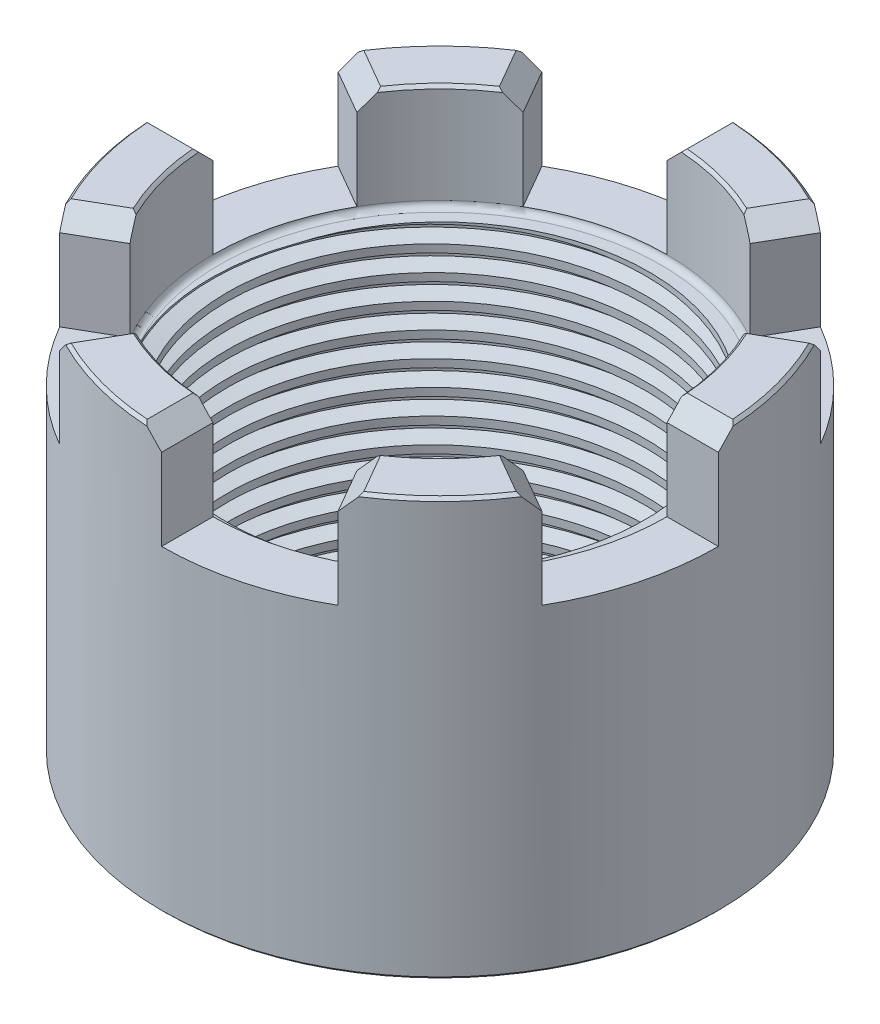
from build123d import *
from build123d.topology import SkipClean

# Parameters (mm, degrees)
SKETCH1_R           = 35.56
BOSS_EXTRUDE1_DEPTH = 40.64
SKETCH2_R           = 26.70175
CUT_EXTRUDE1_DEPTH  = 67.31
BOSS_EXTRUDE2_DEPTH = 12.7
CHAMFER1_SIZE       = 2.286
CHAMFER2_SIZE       = 2.286
CHAMFER3_SIZE       = 2.286
CHAMFER4_SIZE       = 2.286
CHAMFER5_SIZE       = 2.286
CHAMFER6_SIZE       = 2.286
CHAMFER7_SIZE       = 2.286
CHAMFER8_SIZE       = 2.286
CHAMFER9_SIZE       = 2.286
CHAMFER10_SIZE      = 2.286
CHAMFER11_SIZE      = 2.286
CHAMFER12_SIZE      = 2.286
CHAMFER13_SIZE      = 0.381
CHAMFER14_SIZE      = 0.381
CHAMFER15_SIZE      = 0.381
CHAMFER16_SIZE      = 0.381
CHAMFER17_SIZE      = 0.381
CHAMFER18_SIZE      = 0.381
CHAMFER20_SIZE      = 0.381
CHAMFER21_SIZE      = 0.381
CHAMFER22_SIZE      = 0.381
CHAMFER23_SIZE      = 0.381
CHAMFER24_SIZE      = 0.381
CHAMFER25_SIZE      = 0.381
CHAMFER26_SIZE      = 0.381
CUT_EXTRUDE2_START  = -0.762
SKETCH4_R           = 28.9941
CUT_EXTRUDE2_DEPTH  = 0.762
FILLET1_R           = 0.762
THREAD3_PITCH       = 3.175


with BuildPart() as part:
    # Sketch1 → Boss-Extrude1 (new body)
    with BuildSketch(Plane(origin=(0, 0, 0), x_dir=(1, 0, 0), z_dir=(0, 1, 0))):
        with Locations(Location((0, 0, 0), (0, 0, 270))):
            Circle(SKETCH1_R)
    extrude(amount=BOSS_EXTRUDE1_DEPTH)

    # Sketch2 → Cut-Extrude1 (cut)
    with BuildSketch(Plane(origin=(0, 40.64, 0), x_dir=(1, 0, 0), z_dir=(0, 1, 0))):
        with Locations(Location((0, 0, 0), (0, 0, 270))):
            Circle(SKETCH2_R)
    extrude(amount=-CUT_EXTRUDE1_DEPTH, mode=Mode.SUBTRACT)

    # Sketch3 → Boss-Extrude2 (add)
    with SkipClean():  # the faces are left unmerged after this step: merging them gives an invalid solid
        with BuildSketch(Plane(origin=(0, 40.64, 0), x_dir=(1, 0, 0), z_dir=(0, 1, 0))):
            with BuildLine():
                Line((-28.9941, 0), (-35.56, 0))
                ThreePointArc((-35.56, 0), (-34.348322383, -9.203605244), (-30.795863359, -17.78))
                Line((-30.795863359, -17.78), (-25.10962716, -14.49705))
                ThreePointArc((-25.10962716, -14.49705), (-28.00615, -7.504225276), (-28.9941, 0))
            make_face()
            with BuildLine():
                Line((-25.10962716, 14.49705), (-30.795863359, 17.78))
                ThreePointArc((-30.795863359, 17.78), (-25.144717139, 25.144717139), (-17.78, 30.795863359))
                Line((-17.78, 30.795863359), (-14.49705, 25.10962716))
                ThreePointArc((-14.49705, 25.10962716), (-20.501924724, 20.501924724), (-25.10962716, 14.49705))
            make_face()
            with BuildLine():
                Line((0, 28.9941), (0, 35.56))
                ThreePointArc((0, 35.56), (9.203605244, 34.348322383), (17.78, 30.795863359))
                Line((17.78, 30.795863359), (14.49705, 25.10962716))
                ThreePointArc((14.49705, 25.10962716), (7.504225276, 28.00615), (0, 28.9941))
            make_face()
            with BuildLine():
                Line((25.10962716, 14.49705), (30.795863359, 17.78))
                ThreePointArc((30.795863359, 17.78), (34.348322383, 9.203605244), (35.56, 0))
                Line((35.56, 0), (28.9941, 0))
                ThreePointArc((28.9941, 0), (28.00615, 7.504225276), (25.10962716, 14.49705))
            make_face()
            with BuildLine():
                Line((25.10962716, -14.49705), (30.795863359, -17.78))
                ThreePointArc((30.795863359, -17.78), (25.144717139, -25.144717139), (17.78, -30.795863359))
                Line((17.78, -30.795863359), (14.49705, -25.10962716))
                ThreePointArc((14.49705, -25.10962716), (20.501924724, -20.501924724), (25.10962716, -14.49705))
            make_face()
            with BuildLine():
                Line((0, -28.9941), (0, -35.56))
                ThreePointArc((0, -35.56), (-9.203605244, -34.348322383), (-17.78, -30.795863359))
                Line((-17.78, -30.795863359), (-14.49705, -25.10962716))
                ThreePointArc((-14.49705, -25.10962716), (-7.504225276, -28.00615), (0, -28.9941))
            make_face()
        extrude(amount=BOSS_EXTRUDE2_DEPTH)

    # Chamfer1
    chamfer1_edges = [part.edges().sort_by_distance(p)[0] for p in [
        (0, 53.34, 32.27705),
    ]]
    chamfer(chamfer1_edges, length=CHAMFER1_SIZE)

    # Chamfer2
    chamfer2_edges = [part.edges().sort_by_distance(p)[0] for p in [
        (-16.138525, 53.34, 27.952745259),
    ]]
    chamfer(chamfer2_edges, length=CHAMFER2_SIZE)

    # Chamfer3
    chamfer3_edges = [part.edges().sort_by_distance(p)[0] for p in [
        (-27.952745259, 53.34, 16.138525),
    ]]
    chamfer(chamfer3_edges, length=CHAMFER3_SIZE)

    # Chamfer4
    chamfer4_edges = [part.edges().sort_by_distance(p)[0] for p in [
        (16.138525, 53.34, 27.952745259),
    ]]
    chamfer(chamfer4_edges, length=CHAMFER4_SIZE)

    # Chamfer5
    chamfer5_edges = [part.edges().sort_by_distance(p)[0] for p in [
        (27.952745259, 53.34, 16.138525),
    ]]
    chamfer(chamfer5_edges, length=CHAMFER5_SIZE)

    # Chamfer6
    chamfer6_edges = [part.edges().sort_by_distance(p)[0] for p in [
        (32.27705, 53.34, 0),
    ]]
    chamfer(chamfer6_edges, length=CHAMFER6_SIZE)

    # Chamfer7
    chamfer7_edges = [part.edges().sort_by_distance(p)[0] for p in [
        (27.952745259, 53.34, -16.138525),
    ]]
    chamfer(chamfer7_edges, length=CHAMFER7_SIZE)

    # Chamfer8
    chamfer8_edges = [part.edges().sort_by_distance(p)[0] for p in [
        (16.138525, 53.34, -27.952745259),
    ]]
    chamfer(chamfer8_edges, length=CHAMFER8_SIZE)

    # Chamfer9
    chamfer9_edges = [part.edges().sort_by_distance(p)[0] for p in [
        (0, 53.34, -32.27705),
    ]]
    chamfer(chamfer9_edges, length=CHAMFER9_SIZE)

    # Chamfer10
    chamfer10_edges = [part.edges().sort_by_distance(p)[0] for p in [
        (-16.138525, 53.34, -27.952745259),
    ]]
    chamfer(chamfer10_edges, length=CHAMFER10_SIZE)

    # Chamfer11
    chamfer11_edges = [part.edges().sort_by_distance(p)[0] for p in [
        (-27.952745259, 53.34, -16.138525),
    ]]
    chamfer(chamfer11_edges, length=CHAMFER11_SIZE)

    # Chamfer12
    chamfer12_edges = [part.edges().sort_by_distance(p)[0] for p in [
        (-32.27705, 53.34, 0),
    ]]
    chamfer(chamfer12_edges, length=CHAMFER12_SIZE)

    # Chamfer13
    chamfer13_edges = [part.edges().sort_by_distance(p)[0] for p in [
        (9.203605244, 53.34, -34.348322383),
    ]]
    chamfer(chamfer13_edges, length=CHAMFER13_SIZE)

    # Chamfer14
    chamfer14_edges = [part.edges().sort_by_distance(p)[0] for p in [
        (-25.144717139, 53.34, -25.144717139),
    ]]
    chamfer(chamfer14_edges, length=CHAMFER14_SIZE)

    # Chamfer15
    chamfer15_edges = [part.edges().sort_by_distance(p)[0] for p in [
        (-34.348322383, 53.34, 9.203605244),
    ]]
    chamfer(chamfer15_edges, length=CHAMFER15_SIZE)

    # Chamfer16
    chamfer16_edges = [part.edges().sort_by_distance(p)[0] for p in [
        (-9.203605244, 53.34, 34.348322383),
    ]]
    chamfer(chamfer16_edges, length=CHAMFER16_SIZE)

    # Chamfer17
    chamfer17_edges = [part.edges().sort_by_distance(p)[0] for p in [
        (25.144717139, 53.34, 25.144717139),
    ]]
    chamfer(chamfer17_edges, length=CHAMFER17_SIZE)

    # Chamfer18
    chamfer18_edges = [part.edges().sort_by_distance(p)[0] for p in [
        (34.348322383, 53.34, -9.203605244),
    ]]
    chamfer(chamfer18_edges, length=CHAMFER18_SIZE)

    # Chamfer20
    chamfer20_edges = [part.edges().sort_by_distance(p)[0] for p in [
        (-28.00615, 53.34, 7.504225276),
    ]]
    chamfer(chamfer20_edges, length=CHAMFER20_SIZE)

    # Chamfer21
    chamfer21_edges = [part.edges().sort_by_distance(p)[0] for p in [
        (-7.504225276, 53.34, 28.00615),
    ]]
    chamfer(chamfer21_edges, length=CHAMFER21_SIZE)

    # Chamfer22
    chamfer22_edges = [part.edges().sort_by_distance(p)[0] for p in [
        (20.501924724, 53.34, 20.501924724),
    ]]
    chamfer(chamfer22_edges, length=CHAMFER22_SIZE)

    # Chamfer23
    chamfer23_edges = [part.edges().sort_by_distance(p)[0] for p in [
        (-20.501924724, 53.34, -20.501924724),
    ]]
    chamfer(chamfer23_edges, length=CHAMFER23_SIZE)

    # Chamfer24
    chamfer24_edges = [part.edges().sort_by_distance(p)[0] for p in [
        (7.504225276, 53.34, -28.00615),
    ]]
    chamfer(chamfer24_edges, length=CHAMFER24_SIZE)

    # Chamfer25
    chamfer25_edges = [part.edges().sort_by_distance(p)[0] for p in [
        (28.00615, 53.34, -7.504225276),
    ]]
    chamfer(chamfer25_edges, length=CHAMFER25_SIZE)

    # Chamfer26
    chamfer26_edges = [part.edges().sort_by_distance(p)[0] for p in [
        (0, 0, -35.56),
    ]]
    chamfer(chamfer26_edges, length=CHAMFER26_SIZE)

    # Sketch4 → Cut-Extrude2 (cut)
    with BuildSketch(Plane(origin=(0, 40.64, 0), x_dir=(1, 0, 0), z_dir=(0, 1, 0)).offset(CUT_EXTRUDE2_START)):
        with Locations(Location((0, 0, 0), (0, 0, 270))):
            Circle(SKETCH4_R)
    extrude(amount=CUT_EXTRUDE2_DEPTH, mode=Mode.SUBTRACT)

    # Fillet1
    fillet1_edges = [part.edges().sort_by_distance(p)[0] for p in [
        (0, 39.878, -28.9941),
    ]]
    fillet(fillet1_edges, radius=FILLET1_R - 0.0001)  # a hair under: the kernel refuses the full size

    # Thread3: the profile of Thread Profile4 profile screwed along a right-hand helix of 13.6 turns, 12 arcs to a turn; built about Z, then put on its axis
    thread3_z = Axis((0, 0, 0), (0, 0, 1))
    thread3_corners = [(26.70145, 1.2e-08, -7.7585e-05), (26.70145, 1.2e-08, 2.174927466), (28.63088, 1.2e-08, 1.675942941), (28.63088, 1.2e-08, 0.498906941)]
    with BuildLine(mode=Mode.PRIVATE) as thread3_profile:
        Line(thread3_corners[0], thread3_corners[1])
        Line(thread3_corners[1], thread3_corners[2])
        Line(thread3_corners[2], thread3_corners[3])
        Line(thread3_corners[3], thread3_corners[0])
    thread3_cap = Face(thread3_profile.wire())
    thread3_turn_angles = [0, 15, 30, 45, 60, 75, 90, 105, 120, 135, 150, 165, 180, 195, 210, 225, 240, 255, 270, 285, 300, 315, 330, 345, 360]
    thread3_turn_weights = [1, 0.9659258262890683, 1, 0.9659258262890683, 1, 0.9659258262890683, 1, 0.9659258262890683, 1, 0.9659258262890683, 1, 0.9659258262890683, 1, 0.9659258262890683, 1, 0.9659258262890683, 1, 0.9659258262890683, 1, 0.9659258262890683, 1, 0.9659258262890683, 1, 0.9659258262890683, 1]
    thread3_turn_rails = [Edge.make_bspline([Vector(p[0], p[1], 0).rotate(thread3_z, thread3_turn_angles[k]) / thread3_turn_weights[k] + Vector(0, 0, p[2] + THREAD3_PITCH * thread3_turn_angles[k] / 360) for k in range(25)], [0, 0, 0, 1, 1, 2, 2, 3, 3, 4, 4, 5, 5, 6, 6, 7, 7, 8, 8, 9, 9, 10, 10, 11, 11, 12, 12, 12], 2, thread3_turn_weights) for p in thread3_corners]
    thread3_turn_sides = [Face.make_surface_from_curves(thread3_turn_rails[p[0]], thread3_turn_rails[p[1]]) for p in [(0, 1), (1, 2), (2, 3), (3, 0)]]
    thread3_last_angles = [4680, 4695, 4710, 4725, 4740, 4755, 4770, 4785, 4800, 4815, 4830, 4845, 4860, 4875, 4890, 4893, 4896]
    thread3_last_weights = [1, 0.9659258262890683, 1, 0.9659258262890683, 1, 0.9659258262890683, 1, 0.9659258262890683, 1, 0.9659258262890683, 1, 0.9659258262890683, 1, 0.9659258262890683, 1, 0.9986295347545738, 1]
    thread3_last_rails = [Edge.make_bspline([Vector(p[0], p[1], 0).rotate(thread3_z, thread3_last_angles[k]) / thread3_last_weights[k] + Vector(0, 0, p[2] + THREAD3_PITCH * thread3_last_angles[k] / 360) for k in range(17)], [0, 0, 0, 1, 1, 2, 2, 3, 3, 4, 4, 5, 5, 6, 6, 7, 7, 8, 8, 8], 2, thread3_last_weights) for p in thread3_corners]
    thread3_last_sides = [Face.make_surface_from_curves(thread3_last_rails[p[0]], thread3_last_rails[p[1]]) for p in [(0, 1), (1, 2), (2, 3), (3, 0)]]
    thread3 = Plane(origin=(0, 43.18, 0), x_dir=(-0.999847695, 0, -0.017452406), z_dir=(0, -1, 0)) * Solid(Shell([*[p.moved(Location((0, 0, THREAD3_PITCH * i))) for i in range(13) for p in thread3_turn_sides], *thread3_last_sides, thread3_cap, thread3_cap.rotate(thread3_z, 4896).moved(Location((0, 0, THREAD3_PITCH * 4896 / 360)))]))
    add(thread3, mode=Mode.SUBTRACT)


solid = part.part
